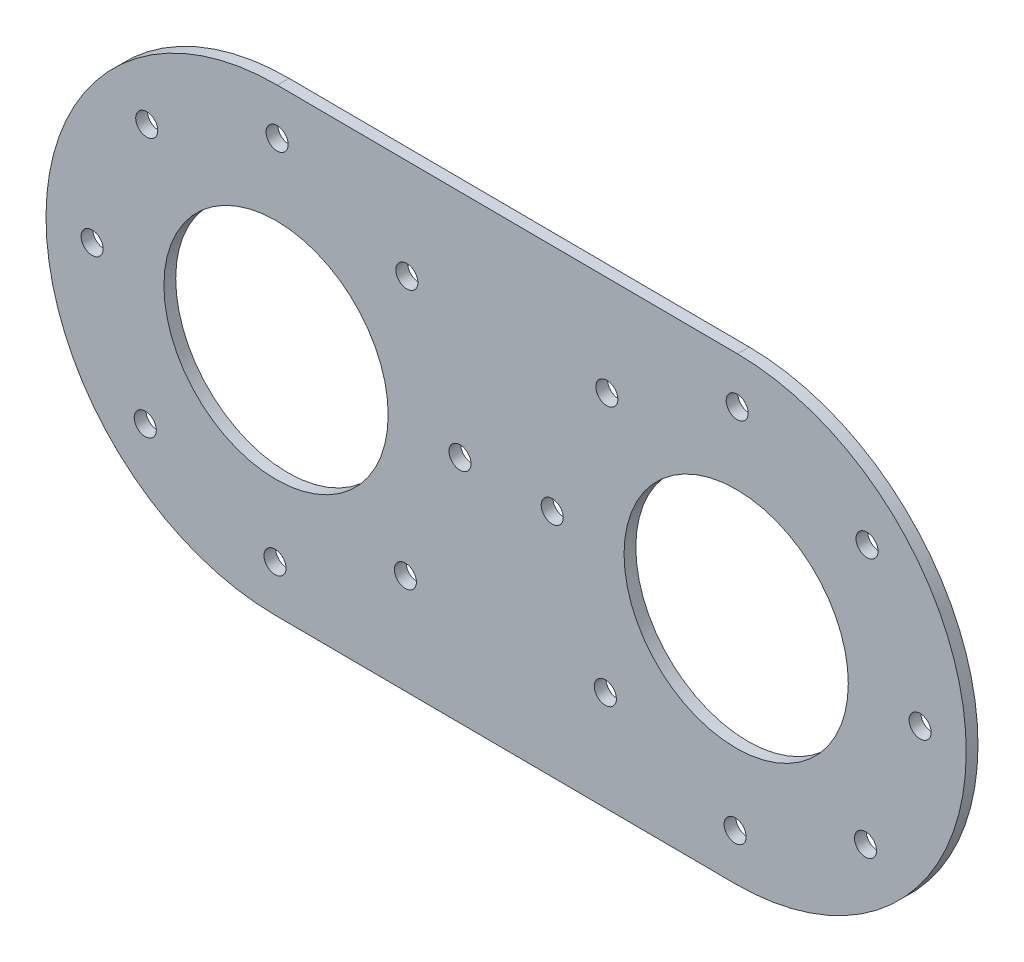
from build123d import *

# Parameters (mm, degrees)
SKETCH1_R           = 0.75
SKETCH1_R_2         = 7.62
BOSS_EXTRUDE1_DEPTH = 0.8


with BuildPart() as part:
    # Sketch1 → Boss-Extrude1 (new body)
    with BuildSketch(Plane.XY):
        with BuildLine():
            ThreePointArc((31.178350927, -19.305614409), (46.900344572, -3.760709545), (31.355439708, 11.961284099))
            Line((31.355439708, 11.961284099), (0.08854439, 12.138372862))
            ThreePointArc((0.08854439, 12.138372862), (-15.633449254, -3.406532002), (-0.08854439, -19.128525646))
            Line((-0.08854439, -19.128525646), (31.178350927, -19.305614409))
        make_face()
        with Locations((18.766895317, -3.601367926)):
            Circle(SKETCH1_R, mode=Mode.SUBTRACT)
        with Locations((31.266895317, -3.672165155)):
            Circle(SKETCH1_R_2, mode=Mode.SUBTRACT)
        with Locations((43.766895317, -3.742962383)):
            Circle(SKETCH1_R, mode=Mode.SUBTRACT)
        with Locations((31.196098089, -16.172165155)):
            Circle(SKETCH1_R, mode=Mode.SUBTRACT)
        with Locations((22.377999352, -12.460938719)):
            Circle(SKETCH1_R, mode=Mode.SUBTRACT)
        with Locations((40.055668882, -12.56106112)):
            Circle(SKETCH1_R, mode=Mode.SUBTRACT)
        with Locations((22.478121753, 5.21673081)):
            Circle(SKETCH1_R, mode=Mode.SUBTRACT)
        with Locations((40.155791283, 5.11660841)):
            Circle(SKETCH1_R, mode=Mode.SUBTRACT)
        with Locations((31.337692546, 8.827834845)):
            Circle(SKETCH1_R, mode=Mode.SUBTRACT)
        with Locations((-12.5, -3.424279164)):
            Circle(SKETCH1_R, mode=Mode.SUBTRACT)
        with Locations((0, -3.495076392)):
            Circle(SKETCH1_R_2, mode=Mode.SUBTRACT)
        with Locations((12.5, -3.565873621)):
            Circle(SKETCH1_R, mode=Mode.SUBTRACT)
        with Locations((8.788773564, -12.383972357)):
            Circle(SKETCH1_R, mode=Mode.SUBTRACT)
        with Locations((-0.070797229, -15.995076392)):
            Circle(SKETCH1_R, mode=Mode.SUBTRACT)
        with Locations((-8.888895965, -12.283849957)):
            Circle(SKETCH1_R, mode=Mode.SUBTRACT)
        with Locations((-8.788773564, 5.393819573)):
            Circle(SKETCH1_R, mode=Mode.SUBTRACT)
        with Locations((8.888895965, 5.293697172)):
            Circle(SKETCH1_R, mode=Mode.SUBTRACT)
        with Locations((0.070797229, 9.004923608)):
            Circle(SKETCH1_R, mode=Mode.SUBTRACT)
    extrude(amount=BOSS_EXTRUDE1_DEPTH)


solid = part.part
